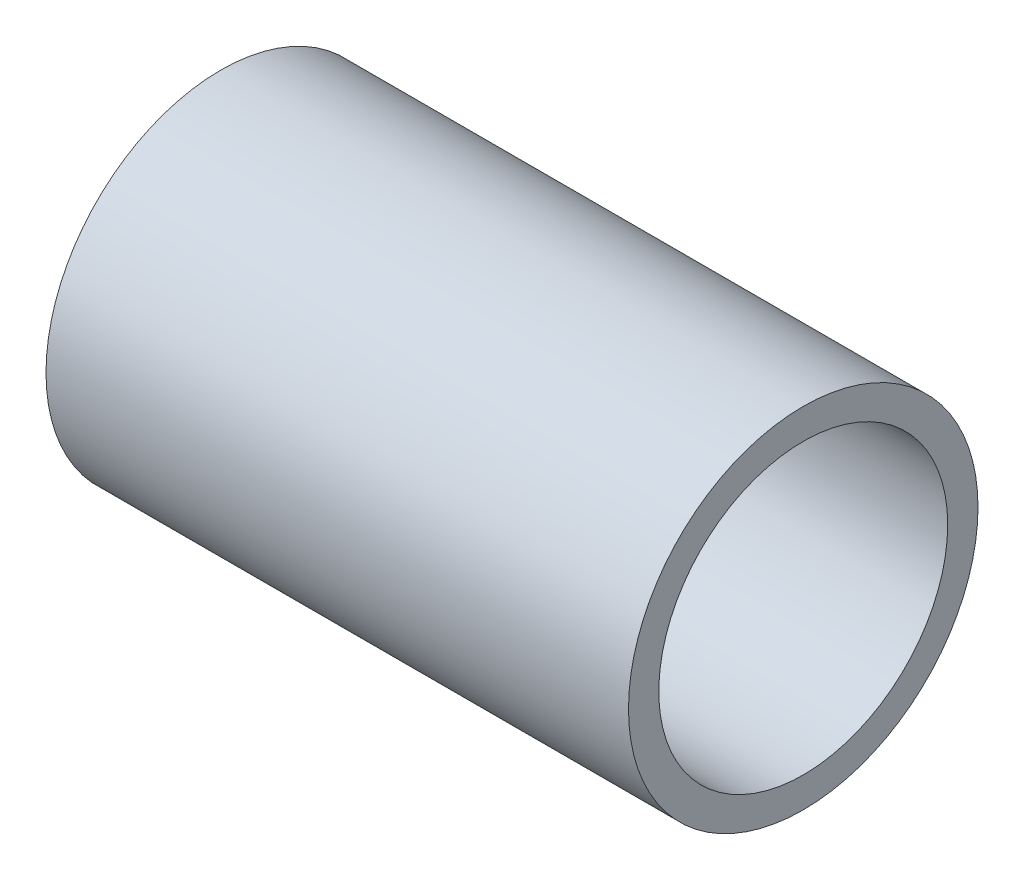
from build123d import *

# Parameters (mm, degrees)
SKETCH1_R           = 9.525
SKETCH1_R_2         = 7.874
BOSS_EXTRUDE1_DEPTH = 15.875


with BuildPart() as part:
    # Sketch1 → Boss-Extrude1 (new, symmetric)
    with BuildSketch(Plane(origin=(0, 0, 0), x_dir=(0, 0, -1), z_dir=(1, 0, 0))):
        Circle(SKETCH1_R)
        Circle(SKETCH1_R_2, mode=Mode.SUBTRACT)
    extrude(amount=BOSS_EXTRUDE1_DEPTH, both=True)


solid = part.part
